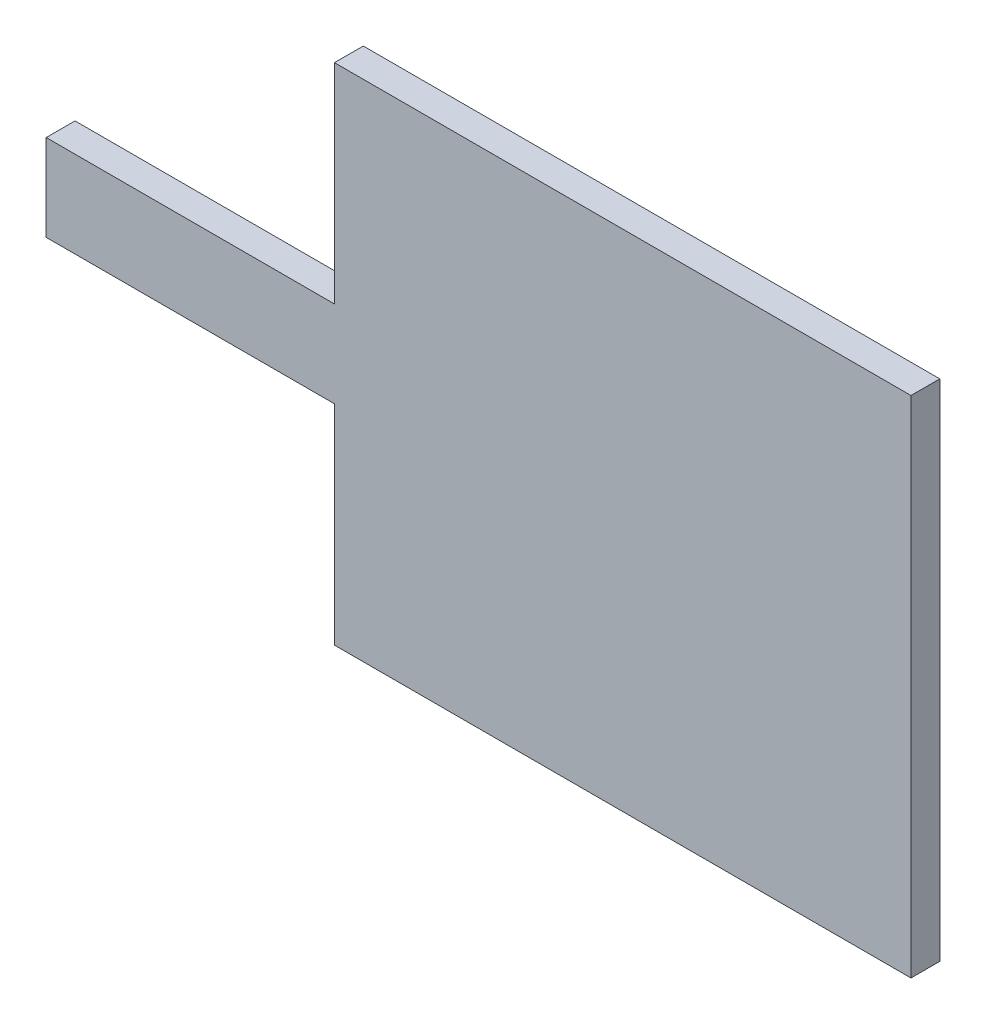
from build123d import *

# Parameters (mm, degrees)
BOSS_EXTRUDE1_DEPTH = 1


with BuildPart() as part:
    # Sketch1 → Boss-Extrude1 (new body)
    with BuildSketch(Plane.XY):
        Polygon((0, 10.25), (0, 17.5), (20, 17.5), (20, 0), (0, 0), (0, 7.25), (-10, 7.25), (-10, 10.25), align=None)
    extrude(amount=BOSS_EXTRUDE1_DEPTH)


solid = part.part
